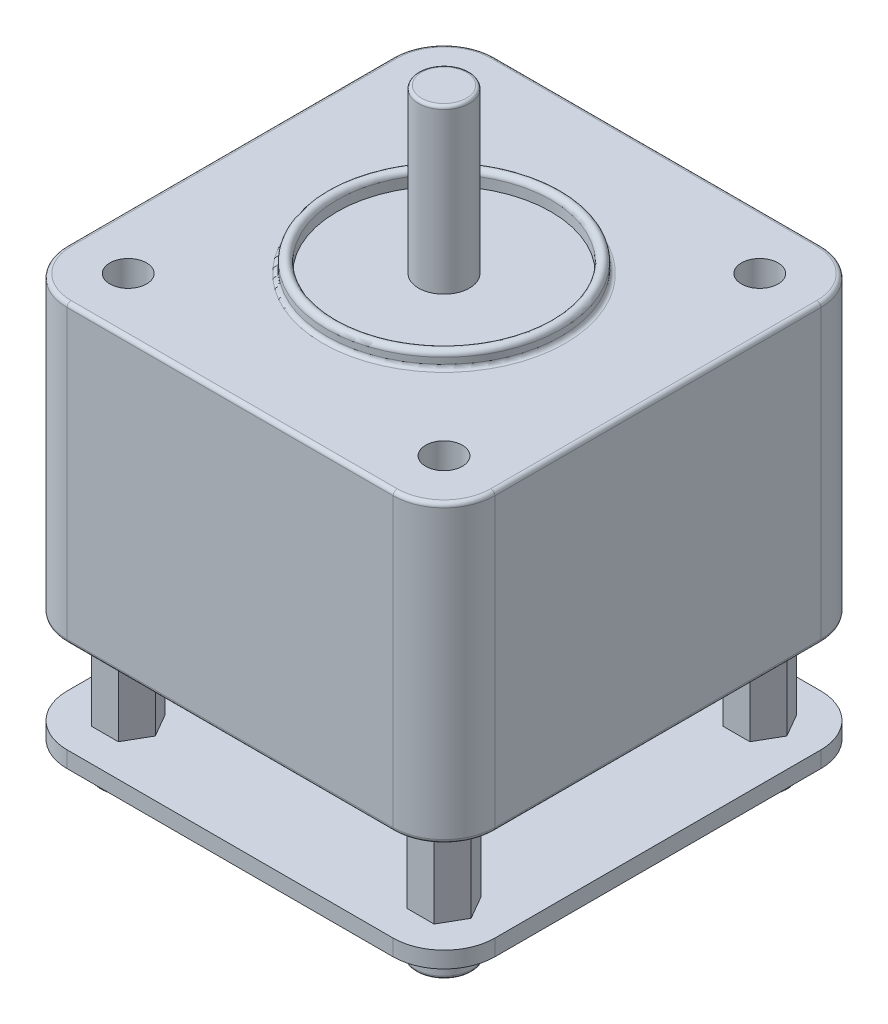
from build123d import *

# Parameters (mm, degrees)
SKETCH_1_W          = 42
SKETCH_1_H          = 42
EXTRUDE_1_DEPTH     = 29
SKETCH_2_R          = 11.5
SKETCH_2_R_2        = 10.5
EXTRUDE_2_DEPTH     = 2
SKETCH_2_3_R        = 2.5
EXTRUDE_3_DEPTH     = 16
SKETCH_4_R          = 1.8
CUT_EXTRUDE_1_DEPTH = 42.509035161
EXTRUDE_4_DEPTH     = 9
SKETCH_6_W          = 42
SKETCH_6_H          = 42
EXTRUDE_5_DEPTH     = 1.6
SKETCH_7_R          = 2.75
EXTRUDE_6_DEPTH     = 3
FILLET_1_R          = 5
FILLET_2_R          = 1
FILLET_3_R          = 0.5
FILLET_4_R          = 0.4
FILLET_5_R          = 0.4
FILLET_6_R          = 0.3
FILLET_7_R          = 0.3


# Some blends are built 0.0001 mm under size
with BuildPart() as part:
    # 草图1 → 凸台-拉伸1 (new body)
    with BuildSketch(Plane(origin=(0, 0, 0), x_dir=(1, 0, 0), z_dir=(0, 1, 0))):
        Rectangle(SKETCH_1_W, SKETCH_1_H)
    extrude(amount=EXTRUDE_1_DEPTH)

    # 草图2 → 凸台-拉伸2 (add)
    with BuildSketch(Plane(origin=(0, 29, 0), x_dir=(1, 0, 0), z_dir=(0, 1, 0))):
        with Locations(Location((0, 0, 0), (0, 0, 270))):
            Circle(SKETCH_2_R)
        with Locations(Location((0, 0, 0), (0, 0, 270))):
            Circle(SKETCH_2_R_2, mode=Mode.SUBTRACT)
    extrude(amount=EXTRUDE_2_DEPTH)

    # 草图2<3> → 凸台-拉伸3 (add)
    with BuildSketch(Plane(origin=(0, 29, 0), x_dir=(1, 0, 0), z_dir=(0, 1, 0))):
        with Locations(Location((0, 0, 0), (0, 0, 270))):
            Circle(SKETCH_2_3_R)
    extrude(amount=EXTRUDE_3_DEPTH)

    # 草图4 → 切除-拉伸1 (cut, through all)
    with BuildSketch(Plane(origin=(0, 29, 0), x_dir=(1, 0, 0), z_dir=(0, 1, 0))):
        with Locations(Location((-15.5, 15.5, 0), (0, 0, 270))):
            Circle(SKETCH_4_R)
        with Locations(Location((15.5, 15.5, 0), (0, 0, 270))):
            Circle(SKETCH_4_R)
        with Locations(Location((15.5, -15.5, 0), (0, 0, 270))):
            Circle(SKETCH_4_R)
        with Locations(Location((-15.5, -15.5, 0), (0, 0, 270))):
            Circle(SKETCH_4_R)
    extrude(amount=-CUT_EXTRUDE_1_DEPTH, mode=Mode.SUBTRACT)

    # 草图5 → 凸台-拉伸4 (add)
    with BuildSketch(Plane.XZ):
        Polygon((-14.172094381, 13.2), (-12.844188762, 15.5), (-14.172094381, 17.8), (-16.827905619, 17.8), (-18.155811238, 15.5), (-16.827905619, 13.2), align=None)
        Polygon((-16.827905619, -13.2), (-14.172094381, -13.2), (-12.844188762, -15.5), (-14.172094381, -17.8), (-16.827905619, -17.8), (-18.155811238, -15.5), align=None)
        Polygon((18.155811238, -15.5), (16.827905619, -13.2), (14.172094381, -13.2), (12.844188762, -15.5), (14.172094381, -17.8), (16.827905619, -17.8), align=None)
        Polygon((16.827905619, 13.2), (14.172094381, 13.2), (12.844188762, 15.5), (14.172094381, 17.8), (16.827905619, 17.8), (18.155811238, 15.5), align=None)
    extrude(amount=EXTRUDE_4_DEPTH)

    # 草图6 → 凸台-拉伸5 (add)
    with BuildSketch(Plane.XZ.offset(9)):
        Rectangle(SKETCH_6_W, SKETCH_6_H)
    extrude(amount=EXTRUDE_5_DEPTH)

    # 草图7 → 凸台-拉伸6 (add)
    # profile 1 of 4: a face of its own
    with BuildSketch(Plane.XZ.offset(10.6)):
        with Locations(Location((-15.5, 15.5, 0), (0, 0, 270))):
            Circle(SKETCH_7_R)
        Polygon((-14.778312164, 14.25), (-14.056624327, 15.5), (-14.778312164, 16.75), (-16.221687836, 16.75), (-16.943375673, 15.5), (-16.221687836, 14.25), align=None, mode=Mode.SUBTRACT)
    # profile 2 of 4: a face of its own
    with BuildSketch(Plane.XZ.offset(10.6)):
        with Locations(Location((15.5, 15.5, 0), (0, 0, 270))):
            Circle(SKETCH_7_R)
        Polygon((16.221687836, 14.25), (16.943375673, 15.5), (16.221687836, 16.75), (14.778312164, 16.75), (14.056624327, 15.5), (14.778312164, 14.25), align=None, mode=Mode.SUBTRACT)
    # profile 3 of 4: a face of its own
    with BuildSketch(Plane.XZ.offset(10.6)):
        with Locations(Location((15.5, -15.5, 0), (0, 0, 270))):
            Circle(SKETCH_7_R)
        Polygon((16.221687836, -16.75), (16.943375673, -15.5), (16.221687836, -14.25), (14.778312164, -14.25), (14.056624327, -15.5), (14.778312164, -16.75), align=None, mode=Mode.SUBTRACT)
    # profile 4 of 4: a face of its own
    with BuildSketch(Plane.XZ.offset(10.6)):
        with Locations(Location((-15.5, -15.5, 0), (0, 0, 270))):
            Circle(SKETCH_7_R)
        Polygon((-14.778312164, -16.75), (-14.056624327, -15.5), (-14.778312164, -14.25), (-16.221687836, -14.25), (-16.943375673, -15.5), (-16.221687836, -16.75), align=None, mode=Mode.SUBTRACT)
    extrude(amount=EXTRUDE_6_DEPTH)

    # 圆角1
    fillet_1_edges = [part.edges().sort_by_distance(p)[0] for p in [
        (21, -9.8, -21),
        (21, -9.8, 21),
        (-21, -9.8, 21),
        (-21, -9.8, -21),
        (21, 14.5, 21),
        (-21, 14.5, 21),
        (-21, 14.5, -21),
        (21, 14.5, -21),
    ]]
    fillet(fillet_1_edges, radius=FILLET_1_R)

    # 圆角2
    fillet_2_edges = [part.edges().sort_by_distance(p)[0] for p in [
        (0, 31, -11.5),
    ]]
    fillet(fillet_2_edges, radius=FILLET_2_R - 0.0001)  # a hair under: the kernel refuses the full size

    # 圆角3
    # the kernel refuses this fillet: 0.5 mm, written as the material it takes off along each edge
    with BuildSketch(Plane(origin=(0, 31, 0), x_dir=(0, 0, 1), z_dir=(-1, 0, 0))) as fillet_3_piece_1:
        with BuildLine():
            CenterArc((11, -0.999898183), FILLET_3_R, 0.0002082, 179.9997918)
            Line((10.5, -0.999898183), (10.45, -0.999898183))
            Line((10.45, -0.999898183), (10.45, 0))
            Line((10.45, 0), (10.5, 0.05))
            ThreePointArc((10.5, 0.05), (10.5001, 0.05), (11.55, -0.999896185))
            Line((11.55, -0.999896185), (11.5, -0.999896367))
        make_face()
    revolve(axis=Axis((0, 31, 0), (0, 1, 0)), mode=Mode.SUBTRACT)

    # 圆角4
    fillet_4_edges = [part.edges().sort_by_distance(p)[0] for p in [
        (0, 29, -11.5),
    ]]
    fillet(fillet_4_edges, radius=FILLET_4_R)

    # 圆角5
    fillet_5_edges = [part.edges().sort_by_distance(p)[0] for p in [
        (-21, 0, 0),
        (-21, 29, 0),
        (21, 0, 0),
        (0, 0, 21),
        (0, 0, -21),
        (19.535533906, 0, -19.535533906),
        (19.535533906, 0, 19.535533906),
        (-19.535533906, 0, 19.535533906),
        (-19.535533906, 0, -19.535533906),
        (0, 29, -21),
        (21, 29, 0),
        (0, 29, 21),
        (19.535533906, 29, -19.535533906),
        (19.535533906, 29, 19.535533906),
        (-19.535533906, 29, 19.535533906),
        (-19.535533906, 29, -19.535533906),
    ]]
    fillet(fillet_5_edges, radius=FILLET_5_R)

    # 圆角6
    fillet_6_edges = [part.edges().sort_by_distance(p)[0] for p in [
        (-15.5, -13.6, 18.25),
        (15.5, -13.6, 18.25),
        (15.5, -13.6, -12.75),
        (-15.5, -13.6, -12.75),
    ]]
    fillet(fillet_6_edges, radius=FILLET_6_R)

    # 圆角7
    fillet_7_edges = [part.edges().sort_by_distance(p)[0] for p in [
        (0, 45, -2.5),
    ]]
    fillet(fillet_7_edges, radius=FILLET_7_R)


solid = part.part
